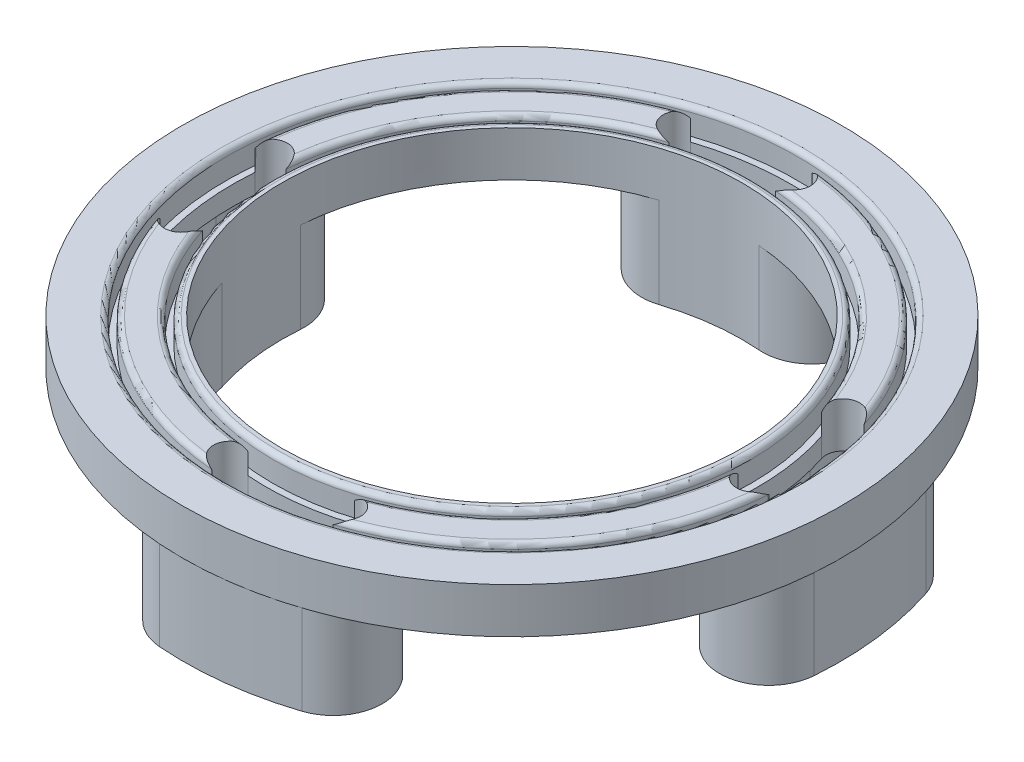
from build123d import *
from build123d.topology import SkipClean

# Parameters (mm, degrees)
SKETCH_1_R          = 25.5
EXTRUDE_1_DEPTH     = 3.5
SKETCH_2_R          = 19
SKETCH_2_R_2        = 18.5
CUT_EXTRUDE_1_DEPTH = 2
SKETCH_3_R          = 22.1
SKETCH_3_R_2        = 21.6
CUT_EXTRUDE_2_DEPTH = 2
FILLET_1_R          = 0.4
CUT_EXTRUDE_5_DEPTH = 37.231892039
EXTRUDE_2_DEPTH     = 7
SKETCH_7_R          = 17.8
CUT_EXTRUDE_7_DEPTH = 10


with BuildPart() as part:
    # 草图1 → 凸台-拉伸1 (new body)
    with BuildSketch(Plane(origin=(0, 0, 0), x_dir=(1, 0, 0), z_dir=(0, 1, 0))):
        Circle(SKETCH_1_R)
    extrude(amount=EXTRUDE_1_DEPTH)

    # 草图2 → 切除-拉伸1 (cut)
    with BuildSketch(Plane(origin=(0, 3.5, 0), x_dir=(1, 0, 0), z_dir=(0, 1, 0))):
        Circle(SKETCH_2_R)
        Circle(SKETCH_2_R_2, mode=Mode.SUBTRACT)
    extrude(amount=-CUT_EXTRUDE_1_DEPTH, mode=Mode.SUBTRACT)

    # 草图3 → 切除-拉伸2 (cut)
    with BuildSketch(Plane(origin=(0, 3.5, 0), x_dir=(1, 0, 0), z_dir=(0, 1, 0))):
        Circle(SKETCH_3_R)
        Circle(SKETCH_3_R_2, mode=Mode.SUBTRACT)
    extrude(amount=-CUT_EXTRUDE_2_DEPTH, mode=Mode.SUBTRACT)

    # 圆角1
    fillet_1_edges = [part.edges().sort_by_distance(p)[0] for p in [
        (-18.5, 3.5, 0),
        (-19, 3.5, 0),
        (-21.6, 3.5, 0),
        (-22.1, 3.5, 0),
    ]]
    fillet(fillet_1_edges, radius=FILLET_1_R)

    # 草图4 → 切除-拉伸5 (cut, through all)
    with BuildSketch(Plane.XZ):
        with BuildLine():
            ThreePointArc((-18.061657485, 5.897162783), (-18.865087187, 2.260195878), (-18.943542169, -1.463629086))
            ThreePointArc((-18.943542169, -1.463629086), (-20.139536222, -2.859909224), (-21.53581636, -1.663915171))
            ThreePointArc((-21.53581636, -1.663915171), (-21.446625434, 2.569485841), (-20.53325272, 6.704142953))
            ThreePointArc((-20.53325272, 6.704142953), (-18.893965018, 7.536450485), (-18.061657485, 5.897162783))
        make_face()
        with BuildLine():
            ThreePointArc((-1.663915171, 21.53581636), (-2.859909224, 20.139536222), (-1.463629086, 18.943542169))
            ThreePointArc((-1.463629086, 18.943542169), (2.260195878, 18.865087187), (5.897162783, 18.061657485))
            ThreePointArc((5.897162783, 18.061657485), (7.536450485, 18.893965018), (6.704142953, 20.53325272))
            ThreePointArc((6.704142953, 20.53325272), (2.569485841, 21.446625434), (-1.663915171, 21.53581636))
        make_face()
        with BuildLine():
            ThreePointArc((21.53581636, 1.663915171), (20.139536222, 2.859909224), (18.943542169, 1.463629086))
            ThreePointArc((18.943542169, 1.463629086), (18.865087187, -2.260195878), (18.061657485, -5.897162783))
            ThreePointArc((18.061657485, -5.897162783), (18.893965018, -7.536450485), (20.53325272, -6.704142953))
            ThreePointArc((20.53325272, -6.704142953), (21.446625434, -2.569485841), (21.53581636, 1.663915171))
        make_face()
        with BuildLine():
            ThreePointArc((1.663915171, -21.53581636), (2.859909224, -20.139536222), (1.463629086, -18.943542169))
            ThreePointArc((1.463629086, -18.943542169), (-2.260195878, -18.865087187), (-5.897162783, -18.061657485))
            ThreePointArc((-5.897162783, -18.061657485), (-7.536450485, -18.893965018), (-6.704142953, -20.53325272))
            ThreePointArc((-6.704142953, -20.53325272), (-2.569485841, -21.446625434), (1.663915171, -21.53581636))
        make_face()
    extrude(amount=-CUT_EXTRUDE_5_DEPTH, mode=Mode.SUBTRACT)

    # 草图5 → 凸台-拉伸2 (add)
    # profile 1 of 4: a face of its own
    with BuildSketch(Plane.XZ):
        with BuildLine():
            ThreePointArc((5.524710396, 16.920921223), (10.31647445, 19.353820164), (7.883575509, 24.145584217))
            ThreePointArc((7.883575509, 24.145584217), (3.021525016, 25.219642872), (-1.956640988, 25.324524794))
            ThreePointArc((-1.956640988, 25.324524794), (-5.452623605, 21.243090543), (-1.371189354, 17.747107927))
            ThreePointArc((-1.371189354, 17.747107927), (2.117446665, 17.673607997), (5.524710396, 16.920921223))
        make_face()
        with BuildLine():
            ThreePointArc((5.679898891, 17.396227999), (9.841167674, 19.509008658), (7.728387015, 23.670277441))
            ThreePointArc((7.728387015, 23.670277441), (2.962046178, 24.723193209), (-1.918124434, 24.826010526))
            ThreePointArc((-1.918124434, 24.826010526), (-4.954109337, 21.281607098), (-1.409705909, 18.245622194))
            ThreePointArc((-1.409705909, 18.245622194), (2.176925504, 18.17005766), (5.679898891, 17.396227999))
        make_face(mode=Mode.SUBTRACT)
    # profile 2 of 4: a face of its own
    with BuildSketch(Plane.XZ):
        with BuildLine():
            ThreePointArc((16.920921223, -5.524710396), (19.353820164, -10.31647445), (24.145584217, -7.883575509))
            ThreePointArc((24.145584217, -7.883575509), (25.219642872, -3.021525016), (25.324524794, 1.956640988))
            ThreePointArc((25.324524794, 1.956640988), (21.243090543, 5.452623605), (17.747107927, 1.371189354))
            ThreePointArc((17.747107927, 1.371189354), (17.673607997, -2.117446665), (16.920921223, -5.524710396))
        make_face()
        with BuildLine():
            ThreePointArc((17.396227999, -5.679898891), (19.509008658, -9.841167674), (23.670277441, -7.728387015))
            ThreePointArc((23.670277441, -7.728387015), (24.723193209, -2.962046178), (24.826010526, 1.918124434))
            ThreePointArc((24.826010526, 1.918124434), (21.281607098, 4.954109337), (18.245622194, 1.409705909))
            ThreePointArc((18.245622194, 1.409705909), (18.17005766, -2.176925504), (17.396227999, -5.679898891))
        make_face(mode=Mode.SUBTRACT)
    # profile 3 of 4: a face of its own
    with BuildSketch(Plane.XZ):
        with BuildLine():
            ThreePointArc((-5.524710396, -16.920921223), (-10.31647445, -19.353820164), (-7.883575509, -24.145584217))
            ThreePointArc((-7.883575509, -24.145584217), (-3.021525016, -25.219642872), (1.956640988, -25.324524794))
            ThreePointArc((1.956640988, -25.324524794), (5.452623605, -21.243090543), (1.371189354, -17.747107927))
            ThreePointArc((1.371189354, -17.747107927), (-2.117446665, -17.673607997), (-5.524710396, -16.920921223))
        make_face()
        with BuildLine():
            ThreePointArc((-5.679898891, -17.396227999), (-2.176925504, -18.17005766), (1.409705909, -18.245622194))
            ThreePointArc((1.409705909, -18.245622194), (4.954109337, -21.281607098), (1.918124434, -24.826010526))
            ThreePointArc((1.918124434, -24.826010526), (-2.962046178, -24.723193209), (-7.728387015, -23.670277441))
            ThreePointArc((-7.728387015, -23.670277441), (-9.841167674, -19.509008658), (-5.679898891, -17.396227999))
        make_face(mode=Mode.SUBTRACT)
    # profile 4 of 4: a face of its own
    with BuildSketch(Plane.XZ):
        with BuildLine():
            ThreePointArc((-16.920921223, 5.524710396), (-17.673607997, 2.117446665), (-17.747107927, -1.371189354))
            ThreePointArc((-17.747107927, -1.371189354), (-21.243090543, -5.452623605), (-25.324524794, -1.956640988))
            ThreePointArc((-25.324524794, -1.956640988), (-25.219642872, 3.021525016), (-24.145584217, 7.883575509))
            ThreePointArc((-24.145584217, 7.883575509), (-19.353820164, 10.31647445), (-16.920921223, 5.524710396))
        make_face()
        with BuildLine():
            ThreePointArc((-17.396227999, 5.679898891), (-18.17005766, 2.176925504), (-18.245622194, -1.409705909))
            ThreePointArc((-18.245622194, -1.409705909), (-21.281607098, -4.954109337), (-24.826010526, -1.918124434))
            ThreePointArc((-24.826010526, -1.918124434), (-24.723193209, 2.962046178), (-23.670277441, 7.728387015))
            ThreePointArc((-23.670277441, 7.728387015), (-19.509008658, 9.841167674), (-17.396227999, 5.679898891))
        make_face(mode=Mode.SUBTRACT)
    extrude(amount=EXTRUDE_2_DEPTH)

    # 草图7 → 切除-拉伸7 (cut)
    with SkipClean():  # the faces are left unmerged after this step: merging them gives an invalid solid
        with BuildSketch(Plane(origin=(0, 3.5, 0), x_dir=(1, 0, 0), z_dir=(0, 1, 0))):
            Circle(SKETCH_7_R)
        extrude(amount=-CUT_EXTRUDE_7_DEPTH, mode=Mode.SUBTRACT)


solid = part.part
